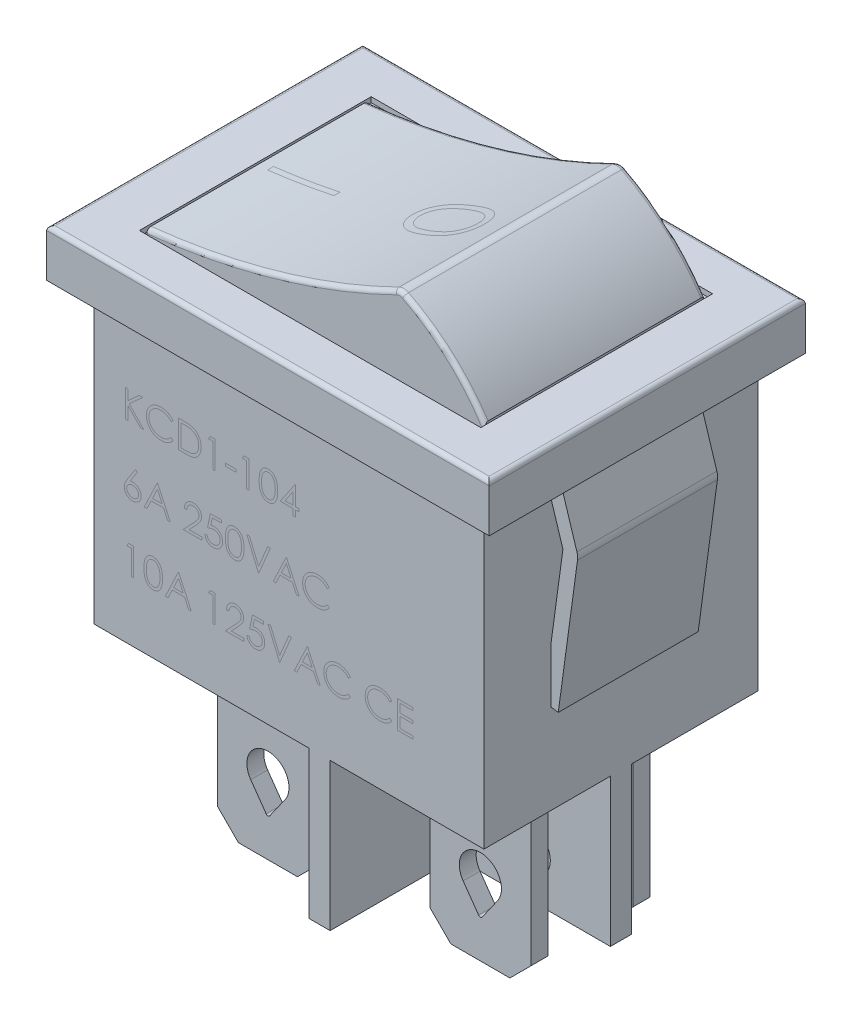
from build123d import *

# Parameters (mm, degrees)
SKETCH1_W               = 18.5
SKETCH1_H               = 14
BOSS_EXTRUDE1_DEPTH     = 6.5
SKETCH2_W               = 21
SKETCH2_H               = 15
BOSS_EXTRUDE2_DEPTH     = 2.25
SKETCH11_W              = 16.2
SKETCH11_H              = 11
CUT_EXTRUDE6_DEPTH      = 0.25
BOSS_EXTRUDE3_DEPTH     = 5.25
BOSS_EXTRUDE4_DEPTH     = 7
SKETCH5_W               = 4.8
SKETCH5_H               = 0.8
BOSS_EXTRUDE5_DEPTH     = 8.36
CHAMFER2_SIZE           = 1
CUT_EXTRUDE1_DEPTH      = 22.276324871
CUT_EXTRUDE1_DEPTH_BACK = 22.276324871
EXTRUDE_THIN14_DEPTH    = 3.32
EXTRUDE_THIN14_2_DEPTH  = 3.32
SKETCH10_W              = 18.5
SKETCH10_H              = 14
CUT_EXTRUDE5_DEPTH      = 22.531402872
FILLET_1_R              = 0.2
FILLET_2_R              = 0.2


with BuildPart() as part:
    # Sketch1 → Boss-Extrude1 (new, symmetric)
    with BuildSketch(Plane.XY):
        Rectangle(SKETCH1_W, SKETCH1_H)
    extrude(amount=BOSS_EXTRUDE1_DEPTH, both=True)

    # Sketch2 → Boss-Extrude2 (add)
    with BuildSketch(Plane(origin=(0, 7, 0), x_dir=(1, 0, 0), z_dir=(0, 1, 0))):
        Rectangle(SKETCH2_W, SKETCH2_H)
    extrude(amount=BOSS_EXTRUDE2_DEPTH)

    # Sketch11 → Cut-Extrude6 (cut)
    with BuildSketch(Plane(origin=(0, 9.25, 0), x_dir=(1, 0, 0), z_dir=(0, 1, 0))):
        Rectangle(SKETCH11_W, SKETCH11_H)
    extrude(amount=-CUT_EXTRUDE6_DEPTH, mode=Mode.SUBTRACT)

    # Sketch3 → Boss-Extrude3 (add, symmetric)
    with BuildSketch(Plane.XY):
        with BuildLine():
            Line((-8, 9.25), (-8, 8.95))
            Line((-8, 8.95), (8, 8.95))
            Line((8, 8.95), (8, 9.25))
            ThreePointArc((8, 9.25), (6.332161172, 11.186092114), (4.22808193, 12.636260923))
            ThreePointArc((4.22808193, 12.636260923), (4.004027777, 12.691667808), (3.778958794, 12.640539155))
            ThreePointArc((3.778958794, 12.640539155), (-1.960941504, 10.425621826), (-8, 9.25))
        make_face()
    extrude(amount=BOSS_EXTRUDE3_DEPTH, both=True)

    # Sketch4 → Boss-Extrude4 (add)
    with BuildSketch(Plane(origin=(0, -7, 0), x_dir=(-1, 0, 0), z_dir=(0, -1, 0))):
        Polygon((-0.95, 6.5), (-1.95, 6.5), (-1.95, 0.5), (-9.25, 0.5), (-9.25, -0.5), (-1.95, -0.5), (-1.95, -6.5), (-0.95, -6.5), (-0.95, -0.5), (9.25, -0.5), (9.25, 0.5), (-0.95, 0.5), align=None)
    extrude(amount=BOSS_EXTRUDE4_DEPTH)

    # Sketch5 → Boss-Extrude5 (add)
    with BuildSketch(Plane.XZ.offset(7)):
        with Locations((5.4, 2.42)):
            Rectangle(SKETCH5_W, SKETCH5_H)
        with Locations((-3.8, -3.3)):
            Rectangle(SKETCH5_W, SKETCH5_H)
        with Locations((5.4, -2.42)):
            Rectangle(SKETCH5_W, SKETCH5_H)
        with Locations((-3.8, 3.3)):
            Rectangle(SKETCH5_W, SKETCH5_H)
    extrude(amount=BOSS_EXTRUDE5_DEPTH)

    # Chamfer2
    chamfer2_edges = [part.edges().sort_by_distance(p)[0] for p in [
        (7.8, -15.36, 2.42),
        (3, -15.36, 2.42),
        (-1.4, -15.36, -3.3),
        (-6.2, -15.36, -3.3),
        (7.8, -15.36, -2.42),
        (3, -15.36, -2.42),
        (-1.4, -15.36, 3.3),
        (-6.2, -15.36, 3.3),
    ]]
    chamfer(chamfer2_edges, length=CHAMFER2_SIZE)

    # Sketch6 → Cut-Extrude1 (cut, two sides: drawn at the far end of the back side and taken through both)
    with BuildSketch(Plane.XY.offset(2.82).offset(-CUT_EXTRUDE1_DEPTH_BACK)):
        with BuildLine():
            Line((5.318320152, -13.517692308), (4.583201516, -12.476923077))
            ThreePointArc((4.583201516, -12.476923077), (5.4, -10.9), (6.216798484, -12.476923077))
            Line((6.216798484, -12.476923077), (5.481679848, -13.517692308))
            ThreePointArc((5.481679848, -13.517692308), (5.4, -13.56), (5.318320152, -13.517692308))
        make_face()
        with BuildLine():
            Line((-3.881679848, -13.517692308), (-4.616798484, -12.476923077))
            ThreePointArc((-4.616798484, -12.476923077), (-3.8, -10.9), (-2.983201516, -12.476923077))
            Line((-2.983201516, -12.476923077), (-3.718320152, -13.517692308))
            ThreePointArc((-3.718320152, -13.517692308), (-3.8, -13.56), (-3.881679848, -13.517692308))
        make_face()
    extrude(amount=CUT_EXTRUDE1_DEPTH + CUT_EXTRUDE1_DEPTH_BACK, mode=Mode.SUBTRACT)

    # Скругление1
    fillet_1_edges = [part.edges().sort_by_distance(p)[0] for p in [
        (10.5, 9.25, 0),
        (0, 9.25, 7.5),
        (-10.5, 9.25, 0),
        (0, 9.25, -7.5),
    ]]
    fillet(fillet_1_edges, radius=FILLET_1_R)

    # Скругление2
    fillet_2_edges = [part.edges().sort_by_distance(p)[0] for p in [
        (6.332161172, 11.186092114, -5.25),
        (4.004027777, 12.691667808, -5.25),
        (6.332161172, 11.186092114, 5.25),
        (4.004027777, 12.691667808, 5.25),
        (-1.960941504, 10.425621826, -5.25),
        (-1.960941504, 10.425621826, 5.25),
    ]]
    fillet(fillet_2_edges, radius=FILLET_2_R)


with BuildPart() as body_2:
    # Sketch9 → Extrude-Thin14 (new, symmetric)
    with BuildSketch(Plane.XY):
        with BuildLine():
            Line((-9.583967117, 7.104718503), (-10.482264459, 4.23987833))
            ThreePointArc((-10.482264459, 4.23987833), (-10.5139557, 4.078650393), (-10.509776475, 3.914390487))
            Line((-10.509776475, 3.914390487), (-9.596806058, -2.797175824))
            Line((-9.596806058, -2.797175824), (-8.903193942, -2.702824176))
            Line((-8.903193942, -2.702824176), (-9.81616436, 4.008742135))
            ThreePointArc((-9.81616436, 4.008742135), (-9.816442975, 4.019692796), (-9.814330225, 4.030441325))
            Line((-9.814330225, 4.030441325), (-8.916032883, 6.895281497))
            Line((-8.916032883, 6.895281497), (-9.583967117, 7.104718503))
        make_face()
    extrude(amount=EXTRUDE_THIN14_DEPTH, both=True)


with BuildPart() as body_3:
    # Sketch9 → Extrude-Thin14 2 (new, symmetric)
    with BuildSketch(Plane.XY):
        with BuildLine():
            Line((8.916032883, 6.895281497), (9.814330225, 4.030441325))
            ThreePointArc((9.814330225, 4.030441325), (9.816442975, 4.019692796), (9.81616436, 4.008742135))
            Line((9.81616436, 4.008742135), (8.903193942, -2.702824176))
            Line((8.903193942, -2.702824176), (9.596806058, -2.797175824))
            Line((9.596806058, -2.797175824), (10.509776475, 3.914390487))
            ThreePointArc((10.509776475, 3.914390487), (10.5139557, 4.078650393), (10.482264459, 4.23987833))
            Line((10.482264459, 4.23987833), (9.583967117, 7.104718503))
            Line((9.583967117, 7.104718503), (8.916032883, 6.895281497))
        make_face()
    extrude(amount=EXTRUDE_THIN14_2_DEPTH, both=True)


with BuildPart() as cut_extrude5_tool:
    # Sketch10 → Cut-Extrude5 (new, through all)
    with BuildSketch(Plane.XY.offset(3.32)):
        Rectangle(SKETCH10_W, SKETCH10_H)
    extrude(amount=-CUT_EXTRUDE5_DEPTH)


with BuildPart() as body_2_1:
    add(body_2.part)

    # Cut-Extrude5: cut by cut_extrude5_tool
    add(cut_extrude5_tool.part, mode=Mode.SUBTRACT)


with BuildPart() as body_3_1:
    add(body_3.part)

    # Cut-Extrude5: cut by cut_extrude5_tool
    add(cut_extrude5_tool.part, mode=Mode.SUBTRACT)


solid = Compound([part.part, body_2_1.part, body_3_1.part])
